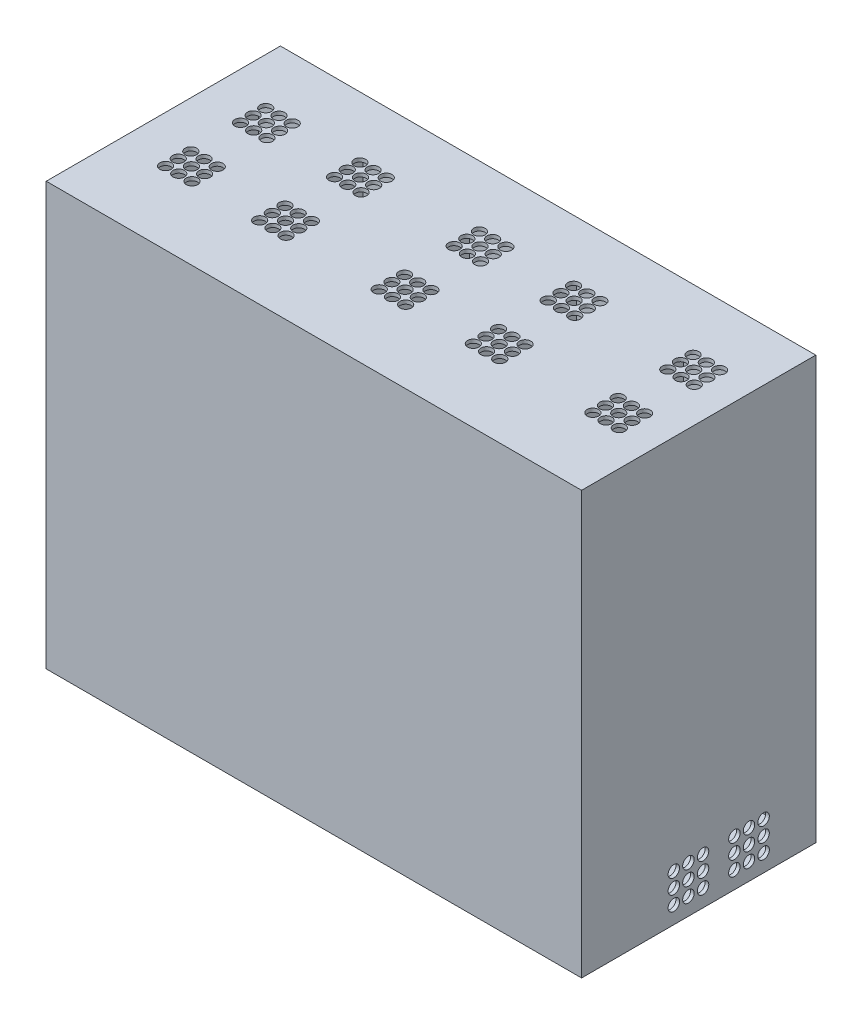
from build123d import *

# Parameters (mm, degrees)
SKETCH1_W            = 465.838
SKETCH1_H            = 367.518
BOSS_EXTRUDE1_DEPTH  = 3.175
SKETCH2_W            = 3.175
SKETCH2_H            = 308.082
BOSS_EXTRUDE2_DEPTH  = 200.6
SKETCH11_W           = 3.175
SKETCH11_H           = 308.082
SKETCH11_H_2         = 3.175
BOSS_EXTRUDE8_DEPTH  = 64.05
SKETCH10_W           = 34.036
SKETCH10_H           = 95.25
SKETCH10_W_2         = 50.8
SKETCH10_H_2         = 34.036
BOSS_EXTRUDE7_DEPTH  = 3.175
CUT_EXTRUDE1_DEPTH   = 578.028772309
SKETCH13_R           = 5
CUT_EXTRUDE2_DEPTH   = 3.175
LPATTERN1_COUNT      = 3
LPATTERN1_PITCH      = 185.920000016
SKETCH14_R           = 5
CUT_EXTRUDE3_DEPTH   = 3.175
LPATTERN2_COUNT      = 2
LPATTERN2_PITCH      = 185.92
CUT_EXTRUDE5_START   = -3.175
SKETCH16_R           = 5
CUT_EXTRUDE5_DEPTH   = 3.175
LPATTERN3_COUNT      = 3
LPATTERN3_PITCH      = 185.92
SKETCH17_R           = 5
CUT_EXTRUDE6_DEPTH   = 605.839795074
LPATTERN4_COUNT      = 2
LPATTERN4_PITCH      = 12.7
LPATTERN4_COL_COUNT  = 2
LPATTERN4_COL_PITCH  = 12.7
SKETCH18_W           = 89.789
SKETCH18_H           = 308.082
SKETCH18_W_2         = 87.632
BOSS_EXTRUDE9_DEPTH  = 19.05
SKETCH19_W           = 89.789
SKETCH19_H           = 308.082
SKETCH19_W_2         = 87.632
BOSS_EXTRUDE10_DEPTH = 30.000000078
SKETCH20_W           = 459.488
SKETCH20_H           = 50.8
BOSS_EXTRUDE11_DEPTH = 45.60000012
SKETCH21_W           = 3.175
SKETCH21_H           = 202.418
CUT_EXTRUDE7_DEPTH   = 64.05
SKETCH22_W           = 50.8
SKETCH22_H           = 34.036
SKETCH22_W_2         = 34.036
SKETCH22_H_2         = 95.25
CUT_EXTRUDE8_DEPTH   = 404.15318355


with BuildPart() as part:
    # Sketch1 → Boss-Extrude1 (new body)
    with BuildSketch(Plane.XY):
        with Locations((-46.4825, -26.543)):
            Rectangle(SKETCH1_W, SKETCH1_H)
    extrude(amount=BOSS_EXTRUDE1_DEPTH)

    # Sketch2 → Boss-Extrude2 (add)
    with BuildSketch(Plane.XY.offset(3.175)):
        Polygon((186.4365, -210.302), (186.4365, -157.216), (183.2615, -157.216), (183.2615, -208.016), (-276.2265, -208.016), (-276.2265, -157.216), (-279.4015, -157.216), (-279.4015, -210.302), align=None)
        Polygon((183.2615, 154.041), (186.4365, 154.041), (186.4365, 157.216), (-279.4015, 157.216), (-279.4015, -157.216), (-276.2265, -157.216), (183.2615, -157.216), (186.4365, -157.216), (186.4365, -154.041), (183.2615, -154.041), (93.4725, -154.041), (90.2975, -154.041), (0.5085, -154.041), (-2.6665, -154.041), (-92.4555, -154.041), (-95.6305, -154.041), (-185.4195, -154.041), (-188.5945, -154.041), (-276.2265, -154.041), (-276.2265, 154.041), (-188.5945, 154.041), (-185.4195, 154.041), (-95.6305, 154.041), (-92.4555, 154.041), (-2.6665, 154.041), (0.5085, 154.041), (90.2975, 154.041), (93.4725, 154.041), align=None)
        with Locations((184.849, 0)):
            Rectangle(SKETCH2_W, SKETCH2_H)
        with Locations((91.885, 0)):
            Rectangle(SKETCH2_W, SKETCH2_H)
        with Locations((-187.007, 0)):
            Rectangle(SKETCH2_W, SKETCH2_H)
        with Locations((-94.043, 0)):
            Rectangle(SKETCH2_W, SKETCH2_H)
        with Locations((-1.079, 0)):
            Rectangle(SKETCH2_W, SKETCH2_H)
    extrude(amount=BOSS_EXTRUDE2_DEPTH)

    # Sketch11 → Boss-Extrude8 (add)
    with BuildSketch(Plane.XY.offset(203.775)):
        Polygon((-279.4015, -210.302), (186.4365, -210.302), (186.4365, -157.216), (183.2615, -157.216), (183.2615, -208.016), (-276.2265, -208.016), (-276.2265, -157.216), (-279.4015, -157.216), align=None)
        with Locations((184.849, 0)):
            Rectangle(SKETCH11_W, SKETCH11_H)
        with Locations((184.849, -155.6285)):
            Rectangle(SKETCH11_W, SKETCH11_H_2)
        Polygon((-279.4015, 157.216), (-279.4015, -157.216), (-276.2265, -157.216), (-276.2265, -154.041), (-276.2265, 154.041), (-188.5945, 154.041), (-185.4195, 154.041), (-95.6305, 154.041), (-92.4555, 154.041), (-2.6665, 154.041), (0.5085, 154.041), (90.2975, 154.041), (93.4725, 154.041), (183.2615, 154.041), (186.4365, 154.041), (186.4365, 157.216), align=None)
    extrude(amount=BOSS_EXTRUDE8_DEPTH)

    # Sketch10 → Boss-Extrude7 (add)
    with BuildSketch(Plane.XY):
        with Locations((203.4545, 109.591)):
            Rectangle(SKETCH10_W, SKETCH10_H)
        with Locations((203.4545, -109.591)):
            Rectangle(SKETCH10_W, SKETCH10_H)
        with Locations((161.0365, 174.234)):
            Rectangle(SKETCH10_W_2, SKETCH10_H_2)
    extrude(amount=BOSS_EXTRUDE7_DEPTH)

    # Sketch12 → Cut-Extrude1 (cut, through all)
    with BuildSketch(Plane(origin=(186.4365, 0, 0), x_dir=(0, 0, -1), z_dir=(1, 0, 0))):
        Polygon((-267.825, -210.302), (-223.375, -210.302), (-267.825, -108.702), align=None)
        Polygon((-267.825, 157.216), (-267.825, 93.716), (-242.425, 157.216), align=None)
    extrude(amount=-CUT_EXTRUDE1_DEPTH, mode=Mode.SUBTRACT)

    # Sketch13 → Cut-Extrude2 (cut)
    with BuildSketch(Plane(origin=(0, 157.216, 0), x_dir=(1, 0, 0), z_dir=(0, 1, 0))):
        with Locations(Location((-227.4105, -53.231662939, 0), (0, 0, 270))):
            Circle(SKETCH13_R)
        with Locations(Location((-238.9105, -53.231662939, 0), (0, 0, 270))):
            Circle(SKETCH13_R)
        with Locations(Location((-238.9105, -64.231662939, 0), (0, 0, 270))):
            Circle(SKETCH13_R)
        with Locations(Location((-227.4105, -64.231662939, 0), (0, 0, 270))):
            Circle(SKETCH13_R)
        with Locations(Location((-215.9105, -64.231662939, 0), (0, 0, 270))):
            Circle(SKETCH13_R)
        with Locations(Location((-238.9105, -75.231662939, 0), (0, 0, 270))):
            Circle(SKETCH13_R)
        with Locations(Location((-227.4105, -75.231662939, 0), (0, 0, 270))):
            Circle(SKETCH13_R)
        with Locations(Location((-215.9105, -75.231662939, 0), (0, 0, 270))):
            Circle(SKETCH13_R)
        with Locations(Location((-238.9105, -129.431662939, 0), (0, 0, 270))):
            Circle(SKETCH13_R)
        with Locations(Location((-227.4105, -129.431662939, 0), (0, 0, 270))):
            Circle(SKETCH13_R)
        with Locations(Location((-238.9105, -140.431662939, 0), (0, 0, 270))):
            Circle(SKETCH13_R)
        with Locations(Location((-227.4105, -140.431662939, 0), (0, 0, 270))):
            Circle(SKETCH13_R)
        with Locations(Location((-215.9105, -140.431662939, 0), (0, 0, 270))):
            Circle(SKETCH13_R)
        with Locations(Location((-215.9105, -129.431662939, 0), (0, 0, 270))):
            Circle(SKETCH13_R)
        with Locations(Location((-215.9105, -118.431662939, 0), (0, 0, 270))):
            Circle(SKETCH13_R)
        with Locations(Location((-215.9105, -53.231662939, 0), (0, 0, 270))):
            Circle(SKETCH13_R)
        with Locations(Location((-238.9105, -118.431662939, 0), (0, 0, 270))):
            Circle(SKETCH13_R)
        with Locations(Location((-227.4105, -118.431662939, 0), (0, 0, 270))):
            Circle(SKETCH13_R)
    cut_extrude2 = extrude(amount=-CUT_EXTRUDE2_DEPTH, mode=Mode.SUBTRACT)

    # LPattern1: Cut-Extrude2 ×3
    with Locations(*[(i * LPATTERN1_PITCH, 0, 0) for i in range(1, LPATTERN1_COUNT)]):
        add(cut_extrude2, mode=Mode.SUBTRACT)

    # Sketch14 → Cut-Extrude3 (cut)
    with BuildSketch(Plane(origin=(0, 157.216, 0), x_dir=(1, 0, 0), z_dir=(0, 1, 0))):
        with Locations(Location((-157.025, -140.431662939, 0), (0, 0, 270))):
            Circle(SKETCH14_R)
        with Locations(Location((-145.525, -140.431662939, 0), (0, 0, 270))):
            Circle(SKETCH14_R)
        with Locations(Location((-134.025, -140.431662939, 0), (0, 0, 270))):
            Circle(SKETCH14_R)
        with Locations(Location((-134.025, -129.431662939, 0), (0, 0, 270))):
            Circle(SKETCH14_R)
        with Locations(Location((-145.525, -129.431662939, 0), (0, 0, 270))):
            Circle(SKETCH14_R)
        with Locations(Location((-157.025, -129.431662939, 0), (0, 0, 270))):
            Circle(SKETCH14_R)
        with Locations(Location((-157.025, -118.431662939, 0), (0, 0, 270))):
            Circle(SKETCH14_R)
        with Locations(Location((-145.525, -118.431662939, 0), (0, 0, 270))):
            Circle(SKETCH14_R)
        with Locations(Location((-134.025, -118.431662939, 0), (0, 0, 270))):
            Circle(SKETCH14_R)
        with Locations(Location((-145.525, -75.231662939, 0), (0, 0, 270))):
            Circle(SKETCH14_R)
        with Locations(Location((-134.025, -75.231662939, 0), (0, 0, 270))):
            Circle(SKETCH14_R)
        with Locations(Location((-134.025, -64.231662939, 0), (0, 0, 270))):
            Circle(SKETCH14_R)
        with Locations(Location((-145.525, -64.231662939, 0), (0, 0, 270))):
            Circle(SKETCH14_R)
        with Locations(Location((-157.025, -64.231662939, 0), (0, 0, 270))):
            Circle(SKETCH14_R)
        with Locations(Location((-157.025, -53.231662939, 0), (0, 0, 270))):
            Circle(SKETCH14_R)
        with Locations(Location((-145.525, -53.231662939, 0), (0, 0, 270))):
            Circle(SKETCH14_R)
        with Locations(Location((-134.025, -53.231662939, 0), (0, 0, 270))):
            Circle(SKETCH14_R)
        with Locations(Location((-157.025, -75.231662939, 0), (0, 0, 270))):
            Circle(SKETCH14_R)
    cut_extrude3 = extrude(amount=-CUT_EXTRUDE3_DEPTH, mode=Mode.SUBTRACT)

    # LPattern2: Cut-Extrude3 ×2
    with Locations(*[(i * LPATTERN2_PITCH, 0, 0) for i in range(1, LPATTERN2_COUNT)]):
        add(cut_extrude3, mode=Mode.SUBTRACT)

    # Sketch16 → Cut-Extrude5 (cut)
    with BuildSketch(Plane.XZ.offset(157.216).offset(CUT_EXTRUDE5_START)):
        with Locations(Location((-215.9105, 140.431662939, 0), (0, 0, 90))):
            Circle(SKETCH16_R)
        with Locations(Location((-227.4105, 140.431662939, 0), (0, 0, 90))):
            Circle(SKETCH16_R)
        with Locations(Location((-238.9105, 140.431662939, 0), (0, 0, 90))):
            Circle(SKETCH16_R)
        with Locations(Location((-215.9105, 129.431662939, 0), (0, 0, 90))):
            Circle(SKETCH16_R)
        with Locations(Location((-238.9105, 129.431662939, 0), (0, 0, 90))):
            Circle(SKETCH16_R)
        with Locations(Location((-227.4105, 129.431662939, 0), (0, 0, 90))):
            Circle(SKETCH16_R)
        with Locations(Location((-215.9105, 118.431662939, 0), (0, 0, 90))):
            Circle(SKETCH16_R)
        with Locations(Location((-227.4105, 118.431662939, 0), (0, 0, 90))):
            Circle(SKETCH16_R)
        with Locations(Location((-238.9105, 118.431662939, 0), (0, 0, 90))):
            Circle(SKETCH16_R)
        with Locations(Location((-215.9105, 107.431662939, 0), (0, 0, 270))):
            Circle(SKETCH16_R)
        with Locations(Location((-227.4105, 107.431662939, 0), (0, 0, 270))):
            Circle(SKETCH16_R)
        with Locations(Location((-238.9105, 107.431662939, 0), (0, 0, 270))):
            Circle(SKETCH16_R)
        with Locations(Location((-215.9105, 96.431662939, 0), (0, 0, 270))):
            Circle(SKETCH16_R)
        with Locations(Location((-227.4105, 96.431662939, 0), (0, 0, 270))):
            Circle(SKETCH16_R)
        with Locations(Location((-238.9105, 96.431662939, 0), (0, 0, 270))):
            Circle(SKETCH16_R)
        with Locations(Location((-215.9105, 85.431662939, 0), (0, 0, 270))):
            Circle(SKETCH16_R)
        with Locations(Location((-227.4105, 74.431662939, 0), (0, 0, 270))):
            Circle(SKETCH16_R)
        with Locations(Location((-227.4105, 85.431662939, 0), (0, 0, 270))):
            Circle(SKETCH16_R)
        with Locations(Location((-238.9105, 85.431662939, 0), (0, 0, 270))):
            Circle(SKETCH16_R)
        with Locations(Location((-238.9105, 74.431662939, 0), (0, 0, 270))):
            Circle(SKETCH16_R)
        with Locations(Location((-227.4105, 63.431662939, 0), (0, 0, 270))):
            Circle(SKETCH16_R)
        with Locations(Location((-238.9105, 63.431662939, 0), (0, 0, 270))):
            Circle(SKETCH16_R)
        with Locations(Location((-238.9105, 52.431662939, 0), (0, 0, 270))):
            Circle(SKETCH16_R)
        with Locations(Location((-238.9105, 41.431662939, 0), (0, 0, 270))):
            Circle(SKETCH16_R)
        with Locations(Location((-238.9105, 30.431662939, 0), (0, 0, 270))):
            Circle(SKETCH16_R)
        with Locations(Location((-227.4105, 30.431662939, 0), (0, 0, 270))):
            Circle(SKETCH16_R)
        with Locations(Location((-215.9105, 30.431662939, 0), (0, 0, 270))):
            Circle(SKETCH16_R)
        with Locations(Location((-215.9105, 41.431662939, 0), (0, 0, 270))):
            Circle(SKETCH16_R)
        with Locations(Location((-227.4105, 41.431662939, 0), (0, 0, 270))):
            Circle(SKETCH16_R)
        with Locations(Location((-227.4105, 52.431662939, 0), (0, 0, 270))):
            Circle(SKETCH16_R)
        with Locations(Location((-215.9105, 52.431662939, 0), (0, 0, 270))):
            Circle(SKETCH16_R)
        with Locations(Location((-215.9105, 74.431662939, 0), (0, 0, 270))):
            Circle(SKETCH16_R)
        with Locations(Location((-215.9105, 63.431662939, 0), (0, 0, 270))):
            Circle(SKETCH16_R)
        with Locations(Location((-134.025, 140.431662939, 0), (0, 0, 90))):
            Circle(SKETCH16_R)
        with Locations(Location((-145.525, 140.431662939, 0), (0, 0, 90))):
            Circle(SKETCH16_R)
        with Locations(Location((-157.025, 140.431662939, 0), (0, 0, 90))):
            Circle(SKETCH16_R)
        with Locations(Location((-134.025, 129.431662939, 0), (0, 0, 90))):
            Circle(SKETCH16_R)
        with Locations(Location((-145.525, 129.431662939, 0), (0, 0, 90))):
            Circle(SKETCH16_R)
        with Locations(Location((-157.025, 129.431662939, 0), (0, 0, 90))):
            Circle(SKETCH16_R)
        with Locations(Location((-134.025, 118.431662939, 0), (0, 0, 90))):
            Circle(SKETCH16_R)
        with Locations(Location((-145.525, 118.431662939, 0), (0, 0, 90))):
            Circle(SKETCH16_R)
        with Locations(Location((-157.025, 118.431662939, 0), (0, 0, 90))):
            Circle(SKETCH16_R)
        with Locations(Location((-134.025, 107.431662939, 0), (0, 0, 270))):
            Circle(SKETCH16_R)
        with Locations(Location((-145.525, 107.431662939, 0), (0, 0, 270))):
            Circle(SKETCH16_R)
        with Locations(Location((-157.025, 107.431662939, 0), (0, 0, 270))):
            Circle(SKETCH16_R)
        with Locations(Location((-134.025, 96.431662939, 0), (0, 0, 270))):
            Circle(SKETCH16_R)
        with Locations(Location((-145.525, 96.431662939, 0), (0, 0, 270))):
            Circle(SKETCH16_R)
        with Locations(Location((-157.025, 96.431662939, 0), (0, 0, 270))):
            Circle(SKETCH16_R)
        with Locations(Location((-134.025, 85.431662939, 0), (0, 0, 270))):
            Circle(SKETCH16_R)
        with Locations(Location((-145.525, 85.431662939, 0), (0, 0, 270))):
            Circle(SKETCH16_R)
        with Locations(Location((-157.025, 85.431662939, 0), (0, 0, 270))):
            Circle(SKETCH16_R)
        with Locations(Location((-134.025, 74.431662939, 0), (0, 0, 270))):
            Circle(SKETCH16_R)
        with Locations(Location((-145.525, 74.431662939, 0), (0, 0, 270))):
            Circle(SKETCH16_R)
        with Locations(Location((-157.025, 74.431662939, 0), (0, 0, 270))):
            Circle(SKETCH16_R)
        with Locations(Location((-134.025, 63.431662939, 0), (0, 0, 270))):
            Circle(SKETCH16_R)
        with Locations(Location((-145.525, 63.431662939, 0), (0, 0, 270))):
            Circle(SKETCH16_R)
        with Locations(Location((-157.025, 63.431662939, 0), (0, 0, 270))):
            Circle(SKETCH16_R)
        with Locations(Location((-134.025, 52.431662939, 0), (0, 0, 270))):
            Circle(SKETCH16_R)
        with Locations(Location((-145.525, 52.431662939, 0), (0, 0, 270))):
            Circle(SKETCH16_R)
        with Locations(Location((-157.025, 52.431662939, 0), (0, 0, 270))):
            Circle(SKETCH16_R)
        with Locations(Location((-134.025, 41.431662939, 0), (0, 0, 270))):
            Circle(SKETCH16_R)
        with Locations(Location((-145.525, 41.431662939, 0), (0, 0, 270))):
            Circle(SKETCH16_R)
        with Locations(Location((-157.025, 41.431662939, 0), (0, 0, 270))):
            Circle(SKETCH16_R)
        with Locations(Location((-134.025, 30.431662939, 0), (0, 0, 270))):
            Circle(SKETCH16_R)
        with Locations(Location((-145.525, 30.431662939, 0), (0, 0, 270))):
            Circle(SKETCH16_R)
        with Locations(Location((-157.025, 30.431662939, 0), (0, 0, 270))):
            Circle(SKETCH16_R)
    cut_extrude5 = extrude(amount=CUT_EXTRUDE5_DEPTH, mode=Mode.SUBTRACT)

    # LPattern3: Cut-Extrude5 ×3
    with Locations(*[(i * LPATTERN3_PITCH, 0, 0) for i in range(1, LPATTERN3_COUNT)]):
        add(cut_extrude5, mode=Mode.SUBTRACT)

    # Sketch17 → Cut-Extrude6 (cut, through all)
    with BuildSketch(Plane.ZY.offset(279.4015)):
        with Locations(Location((110.8, -182.616, 0), (0, 0, 90))):
            Circle(SKETCH17_R)
        with Locations(Location((110.8, -169.916, 0), (0, 0, 90))):
            Circle(SKETCH17_R)
        with Locations(Location((110.8, -195.316, 0), (0, 0, 90))):
            Circle(SKETCH17_R)
        with Locations(Location((58.1, -182.616, 0), (0, 0, 90))):
            Circle(SKETCH17_R)
        with Locations(Location((58.1, -195.316, 0), (0, 0, 90))):
            Circle(SKETCH17_R)
        with Locations(Location((58.1, -169.916, 0), (0, 0, 90))):
            Circle(SKETCH17_R)
    cut_extrude6 = extrude(amount=-CUT_EXTRUDE6_DEPTH, mode=Mode.SUBTRACT)

    # LPattern4: Cut-Extrude6 ×2
    with Locations(*[(0, 0, i * LPATTERN4_PITCH) for i in range(1, LPATTERN4_COUNT)]):
        add(cut_extrude6, mode=Mode.SUBTRACT)

    # LPattern4 col: Cut-Extrude6 ×2
    with Locations(*[(0, 0, -i * LPATTERN4_COL_PITCH) for i in range(1, LPATTERN4_COL_COUNT)]):
        add(cut_extrude6, mode=Mode.SUBTRACT)

    # Sketch18 → Boss-Extrude9 (add)
    with BuildSketch(Plane.XY.offset(3.175)):
        with Locations((138.367, 0)):
            Rectangle(SKETCH18_W, SKETCH18_H)
        with Locations((45.403, 0)):
            Rectangle(SKETCH18_W, SKETCH18_H)
        with Locations((-47.561, 0)):
            Rectangle(SKETCH18_W, SKETCH18_H)
        with Locations((-140.525, 0)):
            Rectangle(SKETCH18_W, SKETCH18_H)
        with Locations((-232.4105, 0)):
            Rectangle(SKETCH18_W_2, SKETCH18_H)
    extrude(amount=BOSS_EXTRUDE9_DEPTH)

    # Sketch19 → Boss-Extrude10 (add)
    with BuildSketch(Plane.XY.offset(173.774999922)):
        with Locations((138.367, 0)):
            Rectangle(SKETCH19_W, SKETCH19_H)
        with Locations((45.403, 0)):
            Rectangle(SKETCH19_W, SKETCH19_H)
        with Locations((-47.561, 0)):
            Rectangle(SKETCH19_W, SKETCH19_H)
        with Locations((-140.525, 0)):
            Rectangle(SKETCH19_W, SKETCH19_H)
        with Locations((-232.4105, 0)):
            Rectangle(SKETCH19_W_2, SKETCH19_H)
    extrude(amount=BOSS_EXTRUDE10_DEPTH)

    # Sketch20 → Boss-Extrude11 (add)
    with BuildSketch(Plane.XY.offset(158.17499988)):
        with Locations((-46.4825, -182.616)):
            Rectangle(SKETCH20_W, SKETCH20_H)
    extrude(amount=BOSS_EXTRUDE11_DEPTH)

    # Sketch21 → Cut-Extrude7 (cut)
    with BuildSketch(Plane.XY.offset(267.825)):
        Polygon((183.2615, -108.702), (183.2615, -208.016), (-276.2265, -208.016), (-276.2265, -108.702), (-276.2265, 93.716), (-276.2265, 154.041), (183.2615, 154.041), (183.2615, 93.716), (186.4365, 93.716), (186.4365, 157.216), (-279.4015, 157.216), (-279.4015, 93.716), (-279.4015, -108.702), (-279.4015, -210.302), (186.4365, -210.302), (186.4365, -108.702), align=None)
        with Locations((184.849, -7.493)):
            Rectangle(SKETCH21_W, SKETCH21_H)
    extrude(amount=-CUT_EXTRUDE7_DEPTH, mode=Mode.SUBTRACT)

    # Sketch22 → Cut-Extrude8 (cut, through all)
    with BuildSketch(Plane.XY.offset(3.175)):
        with Locations((161.0365, 174.234)):
            Rectangle(SKETCH22_W, SKETCH22_H)
        with Locations((203.4545, 109.591)):
            Rectangle(SKETCH22_W_2, SKETCH22_H_2)
        with Locations((203.4545, -109.591)):
            Rectangle(SKETCH22_W_2, SKETCH22_H_2)
    extrude(amount=-CUT_EXTRUDE8_DEPTH, mode=Mode.SUBTRACT)


solid = part.part
